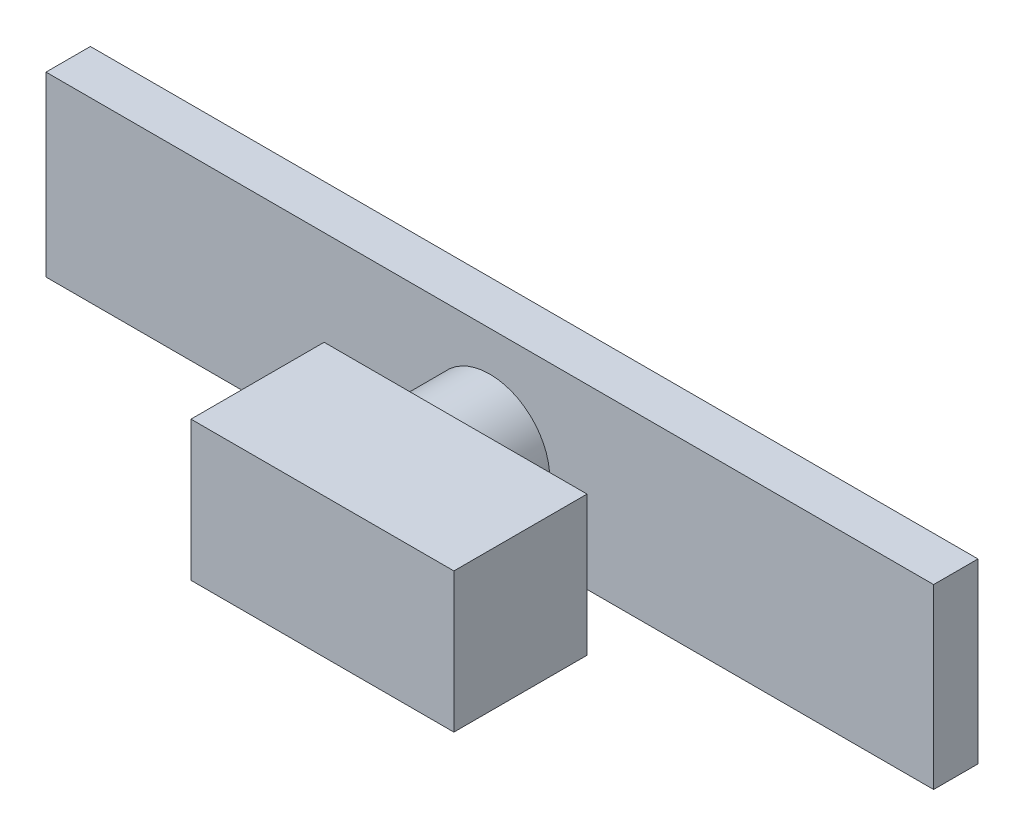
from build123d import *

# Parameters (mm, degrees)
SKETCH2_W             = 254
SKETCH2_H             = 12.7
BOSS_EXTRUDE1_DEPTH   = 50.8
SKETCH3_R             = 17.140791438
BOSS_EXTRUDE2_DEPTH   = 19.05
SKETCH4_W             = 75.235944222
SKETCH4_H             = 39.955088207
BOSS_EXTRUDE3_DEPTH   = 38.1
SCALE2_SCALE          = 0.06
BODY_MOVE_COPY1_ANGLE = 90
SCALE5_SCALE          = 0.25


with BuildPart() as part:
    # Sketch2 → Boss-Extrude1 (new body)
    with BuildSketch(Plane.XY):
        with Locations((79.130769231, 14.898076923)):
            Rectangle(SKETCH2_W, SKETCH2_H)
    extrude(amount=BOSS_EXTRUDE1_DEPTH)

    # Sketch3 → Boss-Extrude2 (add)
    with BuildSketch(Plane(origin=(0, 21.248076923, 0), x_dir=(1, 0, 0), z_dir=(0, 1, 0))):
        with Locations((79.130769231, -28.483063876)):
            Circle(SKETCH3_R)
    extrude(amount=BOSS_EXTRUDE2_DEPTH)

    # Sketch4 → Boss-Extrude3 (add)
    with BuildSketch(Plane(origin=(0, 40.298076923, 0), x_dir=(1, 0, 0), z_dir=(0, 1, 0))):
        with Locations((88.38546847, -28.088530296)):
            Rectangle(SKETCH4_W, SKETCH4_H)
    extrude(amount=BOSS_EXTRUDE3_DEPTH)


with BuildPart() as part_1:
    # Scale2: scaled about (82.711857342, 33.041003565, 26.623476887)
    add(part.part.scale(SCALE2_SCALE).moved(Location((77.749145901, 31.058543351, 25.026068274))))


with BuildPart() as part_2:
    # Body-Move/Copy1: moved
    add(part_1.part.rotate(Axis((0, 33.666927966, 26.550068274), (1, 0, 0)), BODY_MOVE_COPY1_ANGLE))


with BuildPart() as part_3:
    # Body-Move/Copy3: moved
    add(part_2.part.moved(Location((-50.8, 0, -50.8))))


with BuildPart() as part_4:
    # Scale5: scaled about (31.911857342, 33.593519353, -24.875856127)
    add(part_3.part.scale(SCALE5_SCALE).moved(Location((23.933893006, 25.195139515, -18.656892095))))


with BuildPart() as part_5:
    # Body-Move/Copy9: moved
    add(part_4.part.moved(Location((-50.8, 0, 0))))


with BuildPart() as part_6:
    # Body-Move/Copy11: moved
    add(part_5.part.moved(Location((0, 0, -50.8))))


solid = part_6.part
